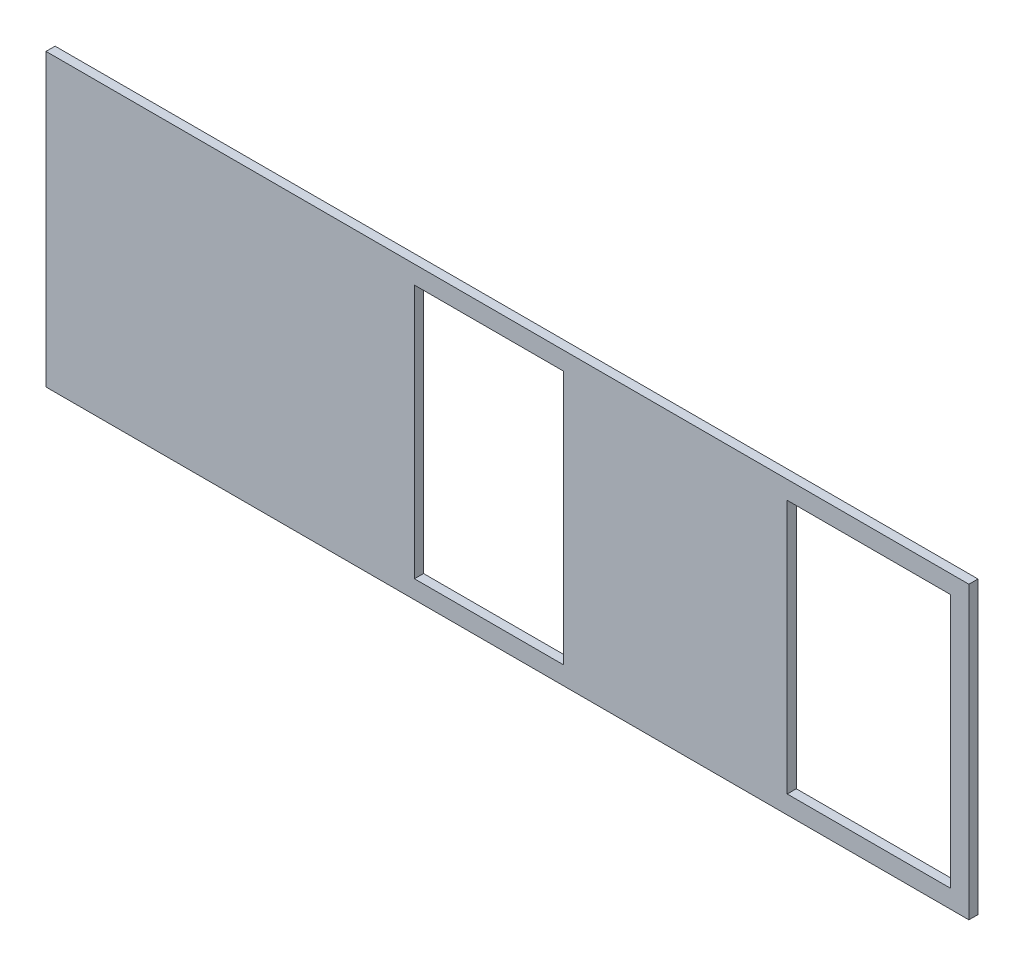
from build123d import *

# Parameters (mm, degrees)
SKETCH1_W           = 322.58
SKETCH1_H           = 101.6
BOSS_EXTRUDE1_DEPTH = 3.175
SKETCH4_W           = 52.07
SKETCH4_H           = 88.9
SKETCH4_W_2         = 57.15
CUT_EXTRUDE1_DEPTH  = 339.216642147


with BuildPart() as part:
    # Sketch1 → Boss-Extrude1 (new body)
    with BuildSketch(Plane.XY):
        with Locations((161.29, 50.8)):
            Rectangle(SKETCH1_W, SKETCH1_H)
    extrude(amount=BOSS_EXTRUDE1_DEPTH)

    # Sketch4 → Cut-Extrude1 (cut, through all)
    with BuildSketch(Plane.XY.offset(3.175)):
        with Locations((154.813, 50.8)):
            Rectangle(SKETCH4_W, SKETCH4_H)
        with Locations((287.655, 50.8)):
            Rectangle(SKETCH4_W_2, SKETCH4_H)
    extrude(amount=-CUT_EXTRUDE1_DEPTH, mode=Mode.SUBTRACT)


solid = part.part
